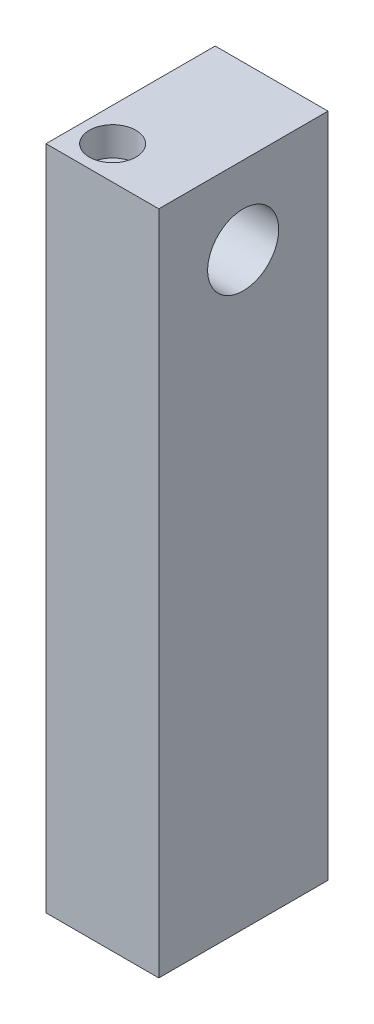
from build123d import *

# Parameters (mm, degrees)
SKETCH1_W           = 50.8
SKETCH1_H           = 76.2
BOSS_EXTRUDE1_DEPTH = 300
SKETCH2_R           = 16
CUT_EXTRUDE1_DEPTH  = 150
SKETCH4_R           = 5.25
CUT_EXTRUDE3_DEPTH  = 50
SKETCH6_R           = 10.5
CUT_EXTRUDE4_DEPTH  = 13


with BuildPart() as part:
    # Sketch1 → Boss-Extrude1 (new body)
    with BuildSketch(Plane(origin=(0, 0, 0), x_dir=(1, 0, 0), z_dir=(0, 1, 0))):
        with Locations((25.4, 38.1)):
            Rectangle(SKETCH1_W, SKETCH1_H)
    extrude(amount=BOSS_EXTRUDE1_DEPTH)

    # Sketch2 → Cut-Extrude1 (cut)
    with BuildSketch(Plane(origin=(50.8, 0, 0), x_dir=(0, 0, -1), z_dir=(1, 0, 0))):
        with Locations((38, 265)):
            Circle(SKETCH2_R)
    extrude(amount=-CUT_EXTRUDE1_DEPTH, mode=Mode.SUBTRACT)

    # Sketch4 → Cut-Extrude3 (cut)
    with BuildSketch(Plane(origin=(0, 300, 0), x_dir=(1, 0, 0), z_dir=(0, 1, 0))):
        with Locations((15, 15)):
            Circle(SKETCH4_R)
    extrude(amount=-CUT_EXTRUDE3_DEPTH, mode=Mode.SUBTRACT)

    # Sketch6 → Cut-Extrude4 (cut)
    with BuildSketch(Plane(origin=(0, 300, 0), x_dir=(1, 0, 0), z_dir=(0, 1, 0))):
        with Locations((15, 15)):
            Circle(SKETCH6_R)
    extrude(amount=-CUT_EXTRUDE4_DEPTH, mode=Mode.SUBTRACT)


solid = part.part
